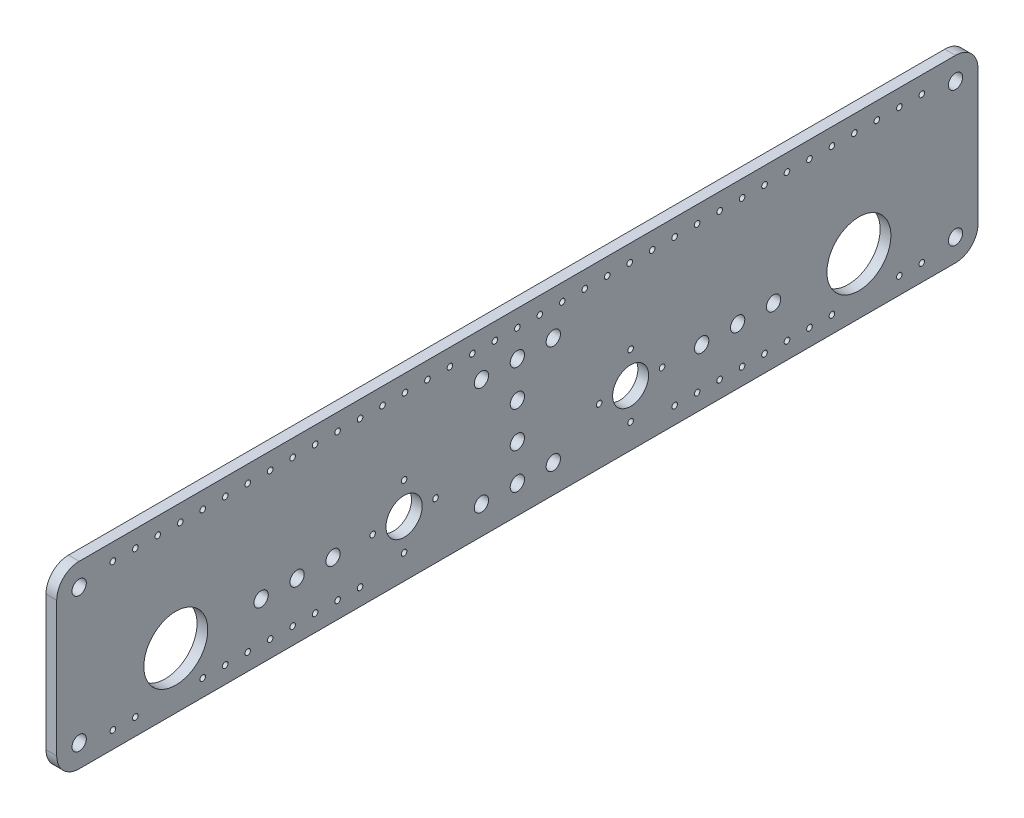
from build123d import *

# Parameters (mm, degrees)
SKETCH2_R           = 14.225
SKETCH2_R_2         = 3.18
SKETCH2_R_3         = 1.25
SKETCH2_R_4         = 8
SKETCH2_R_5         = 8.068284678
BOSS_EXTRUDE1_DEPTH = 4.7625


with BuildPart() as part:
    # Sketch2 → Boss-Extrude1 (new body)
    with BuildSketch(Plane(origin=(0, 0, 0), x_dir=(0, 0, -1), z_dir=(1, 0, 0))):
        with BuildLine():
            Line((-23.472321429, 28.668303571), (-23.472321429, -31.331696429))
            ThreePointArc((-23.472321429, -31.331696429), (-20.54338924, -38.40276424), (-13.472321429, -41.331696429))
            Line((-13.472321429, -41.331696429), (376.527678571, -41.331696429))
            ThreePointArc((376.527678571, -41.331696429), (383.598746383, -38.40276424), (386.527678571, -31.331696429))
            Line((386.527678571, -31.331696429), (386.527678571, 28.668303571))
            ThreePointArc((386.527678571, 28.668303571), (383.598746383, 35.739371383), (376.527678571, 38.668303571))
            Line((376.527678571, 38.668303571), (-13.472321429, 38.668303571))
            ThreePointArc((-13.472321429, 38.668303571), (-20.54338924, 35.739371383), (-23.472321429, 28.668303571))
        make_face()
        with Locations((29.527678571, -16.331696429)):
            Circle(SKETCH2_R, mode=Mode.SUBTRACT)
        with Locations((333.527678571, -16.331696429)):
            Circle(SKETCH2_R, mode=Mode.SUBTRACT)
        with Locations((181.527678571, -28.771696429)):
            Circle(SKETCH2_R_2, mode=Mode.SUBTRACT)
        with Locations((197.527678571, -28.771696429)):
            Circle(SKETCH2_R_2, mode=Mode.SUBTRACT)
        with Locations((197.527678571, 19.228303571)):
            Circle(SKETCH2_R_2, mode=Mode.SUBTRACT)
        with Locations((181.527678571, -12.771696429)):
            Circle(SKETCH2_R_2, mode=Mode.SUBTRACT)
        with Locations((181.527678571, 3.228303571)):
            Circle(SKETCH2_R_2, mode=Mode.SUBTRACT)
        with Locations((181.527678571, 19.228303571)):
            Circle(SKETCH2_R_2, mode=Mode.SUBTRACT)
        with Locations((165.527678571, -28.771696429)):
            Circle(SKETCH2_R_2, mode=Mode.SUBTRACT)
        with Locations((165.527678571, 19.228303571)):
            Circle(SKETCH2_R_2, mode=Mode.SUBTRACT)
        with Locations((83.502678571, -16.331696429)):
            Circle(SKETCH2_R_2, mode=Mode.SUBTRACT)
        with Locations((279.552678571, -16.331696429)):
            Circle(SKETCH2_R_2, mode=Mode.SUBTRACT)
        with Locations((1.527678571, 31.168303571)):
            Circle(SKETCH2_R_3, mode=Mode.SUBTRACT)
        with Locations((11.527678571, 31.168303571)):
            Circle(SKETCH2_R_3, mode=Mode.SUBTRACT)
        with Locations((21.527678571, 31.168303571)):
            Circle(SKETCH2_R_3, mode=Mode.SUBTRACT)
        with Locations((31.527678571, 31.168303571)):
            Circle(SKETCH2_R_3, mode=Mode.SUBTRACT)
        with Locations((41.527678571, 31.168303571)):
            Circle(SKETCH2_R_3, mode=Mode.SUBTRACT)
        with Locations((51.527678571, 31.168303571)):
            Circle(SKETCH2_R_3, mode=Mode.SUBTRACT)
        with Locations((61.527678571, 31.168303571)):
            Circle(SKETCH2_R_3, mode=Mode.SUBTRACT)
        with Locations((71.527678571, 31.168303571)):
            Circle(SKETCH2_R_3, mode=Mode.SUBTRACT)
        with Locations((81.527678571, 31.168303571)):
            Circle(SKETCH2_R_3, mode=Mode.SUBTRACT)
        with Locations((91.527678571, 31.168303571)):
            Circle(SKETCH2_R_3, mode=Mode.SUBTRACT)
        with Locations((101.527678571, 31.168303571)):
            Circle(SKETCH2_R_3, mode=Mode.SUBTRACT)
        with Locations((111.527678571, 31.168303571)):
            Circle(SKETCH2_R_3, mode=Mode.SUBTRACT)
        with Locations((121.527678571, 31.168303571)):
            Circle(SKETCH2_R_3, mode=Mode.SUBTRACT)
        with Locations((131.527678571, 31.168303571)):
            Circle(SKETCH2_R_3, mode=Mode.SUBTRACT)
        with Locations((141.527678571, 31.168303571)):
            Circle(SKETCH2_R_3, mode=Mode.SUBTRACT)
        with Locations((151.527678571, 31.168303571)):
            Circle(SKETCH2_R_3, mode=Mode.SUBTRACT)
        with Locations((161.527678571, 31.168303571)):
            Circle(SKETCH2_R_3, mode=Mode.SUBTRACT)
        with Locations((171.527678571, 31.168303571)):
            Circle(SKETCH2_R_3, mode=Mode.SUBTRACT)
        with Locations((181.527678571, 31.168303571)):
            Circle(SKETCH2_R_3, mode=Mode.SUBTRACT)
        with Locations((191.527678571, 31.168303571)):
            Circle(SKETCH2_R_3, mode=Mode.SUBTRACT)
        with Locations((201.527678571, 31.168303571)):
            Circle(SKETCH2_R_3, mode=Mode.SUBTRACT)
        with Locations((211.527678571, 31.168303571)):
            Circle(SKETCH2_R_3, mode=Mode.SUBTRACT)
        with Locations((221.527678571, 31.168303571)):
            Circle(SKETCH2_R_3, mode=Mode.SUBTRACT)
        with Locations((231.527678571, 31.168303571)):
            Circle(SKETCH2_R_3, mode=Mode.SUBTRACT)
        with Locations((241.527678571, 31.168303571)):
            Circle(SKETCH2_R_3, mode=Mode.SUBTRACT)
        with Locations((251.527678571, 31.168303571)):
            Circle(SKETCH2_R_3, mode=Mode.SUBTRACT)
        with Locations((261.527678571, 31.168303571)):
            Circle(SKETCH2_R_3, mode=Mode.SUBTRACT)
        with Locations((271.527678571, 31.168303571)):
            Circle(SKETCH2_R_3, mode=Mode.SUBTRACT)
        with Locations((281.527678571, 31.168303571)):
            Circle(SKETCH2_R_3, mode=Mode.SUBTRACT)
        with Locations((291.527678571, 31.168303571)):
            Circle(SKETCH2_R_3, mode=Mode.SUBTRACT)
        with Locations((301.527678571, 31.168303571)):
            Circle(SKETCH2_R_3, mode=Mode.SUBTRACT)
        with Locations((311.527678571, 31.168303571)):
            Circle(SKETCH2_R_3, mode=Mode.SUBTRACT)
        with Locations((321.527678571, 31.168303571)):
            Circle(SKETCH2_R_3, mode=Mode.SUBTRACT)
        with Locations((331.527678571, 31.168303571)):
            Circle(SKETCH2_R_3, mode=Mode.SUBTRACT)
        with Locations((341.527678571, 31.168303571)):
            Circle(SKETCH2_R_3, mode=Mode.SUBTRACT)
        with Locations((351.527678571, 31.168303571)):
            Circle(SKETCH2_R_3, mode=Mode.SUBTRACT)
        with Locations((361.527678571, 31.168303571)):
            Circle(SKETCH2_R_3, mode=Mode.SUBTRACT)
        with Locations((1.527678571, -33.831696429)):
            Circle(SKETCH2_R_3, mode=Mode.SUBTRACT)
        with Locations((11.527678571, -33.831696429)):
            Circle(SKETCH2_R_3, mode=Mode.SUBTRACT)
        with Locations((41.527678571, -33.831696429)):
            Circle(SKETCH2_R_3, mode=Mode.SUBTRACT)
        with Locations((51.527678571, -33.831696429)):
            Circle(SKETCH2_R_3, mode=Mode.SUBTRACT)
        with Locations((61.527678571, -33.831696429)):
            Circle(SKETCH2_R_3, mode=Mode.SUBTRACT)
        with Locations((71.527678571, -33.831696429)):
            Circle(SKETCH2_R_3, mode=Mode.SUBTRACT)
        with Locations((81.527678571, -33.831696429)):
            Circle(SKETCH2_R_3, mode=Mode.SUBTRACT)
        with Locations((91.527678571, -33.831696429)):
            Circle(SKETCH2_R_3, mode=Mode.SUBTRACT)
        with Locations((101.527678571, -33.831696429)):
            Circle(SKETCH2_R_3, mode=Mode.SUBTRACT)
        with Locations((111.527678571, -33.831696429)):
            Circle(SKETCH2_R_3, mode=Mode.SUBTRACT)
        with Locations((251.527678571, -33.831696429)):
            Circle(SKETCH2_R_3, mode=Mode.SUBTRACT)
        with Locations((261.527678571, -33.831696429)):
            Circle(SKETCH2_R_3, mode=Mode.SUBTRACT)
        with Locations((271.527678571, -33.831696429)):
            Circle(SKETCH2_R_3, mode=Mode.SUBTRACT)
        with Locations((281.527678571, -33.831696429)):
            Circle(SKETCH2_R_3, mode=Mode.SUBTRACT)
        with Locations((291.527678571, -33.831696429)):
            Circle(SKETCH2_R_3, mode=Mode.SUBTRACT)
        with Locations((301.527678571, -33.831696429)):
            Circle(SKETCH2_R_3, mode=Mode.SUBTRACT)
        with Locations((311.527678571, -33.831696429)):
            Circle(SKETCH2_R_3, mode=Mode.SUBTRACT)
        with Locations((321.527678571, -33.831696429)):
            Circle(SKETCH2_R_3, mode=Mode.SUBTRACT)
        with Locations((351.527678571, -33.831696429)):
            Circle(SKETCH2_R_3, mode=Mode.SUBTRACT)
        with Locations((361.527678571, -33.831696429)):
            Circle(SKETCH2_R_3, mode=Mode.SUBTRACT)
        with Locations((-13.472321429, -31.331696429)):
            Circle(SKETCH2_R_2, mode=Mode.SUBTRACT)
        with Locations((-13.472321429, 28.668303571)):
            Circle(SKETCH2_R_2, mode=Mode.SUBTRACT)
        with Locations((376.527678571, -31.331696429)):
            Circle(SKETCH2_R_2, mode=Mode.SUBTRACT)
        with Locations((376.527678571, 28.668303571)):
            Circle(SKETCH2_R_2, mode=Mode.SUBTRACT)
        with Locations((99.502678571, -16.331696429)):
            Circle(SKETCH2_R_2, mode=Mode.SUBTRACT)
        with Locations((295.552678571, -16.331696429)):
            Circle(SKETCH2_R_2, mode=Mode.SUBTRACT)
        with Locations((67.502678571, -16.331696429)):
            Circle(SKETCH2_R_2, mode=Mode.SUBTRACT)
        with Locations((263.552678571, -16.331696429)):
            Circle(SKETCH2_R_2, mode=Mode.SUBTRACT)
        with Locations((131.127678571, -30.331696429)):
            Circle(SKETCH2_R_3, mode=Mode.SUBTRACT)
        with Locations((145.127678571, -16.331696429)):
            Circle(SKETCH2_R_3, mode=Mode.SUBTRACT)
        with Locations((131.127678571, -2.331696429)):
            Circle(SKETCH2_R_3, mode=Mode.SUBTRACT)
        with Locations((117.127678571, -16.331696429)):
            Circle(SKETCH2_R_3, mode=Mode.SUBTRACT)
        with Locations((231.927678571, -30.331696429)):
            Circle(SKETCH2_R_3, mode=Mode.SUBTRACT)
        with Locations((217.927678571, -16.331696429)):
            Circle(SKETCH2_R_3, mode=Mode.SUBTRACT)
        with Locations((231.927678571, -2.331696429)):
            Circle(SKETCH2_R_3, mode=Mode.SUBTRACT)
        with Locations((245.927678571, -16.331696429)):
            Circle(SKETCH2_R_3, mode=Mode.SUBTRACT)
        with Locations((231.927678571, -16.331696429)):
            Circle(SKETCH2_R_4, mode=Mode.SUBTRACT)
        with Locations((131.127678571, -16.331696429)):
            Circle(SKETCH2_R_5, mode=Mode.SUBTRACT)
    extrude(amount=BOSS_EXTRUDE1_DEPTH)


solid = part.part
